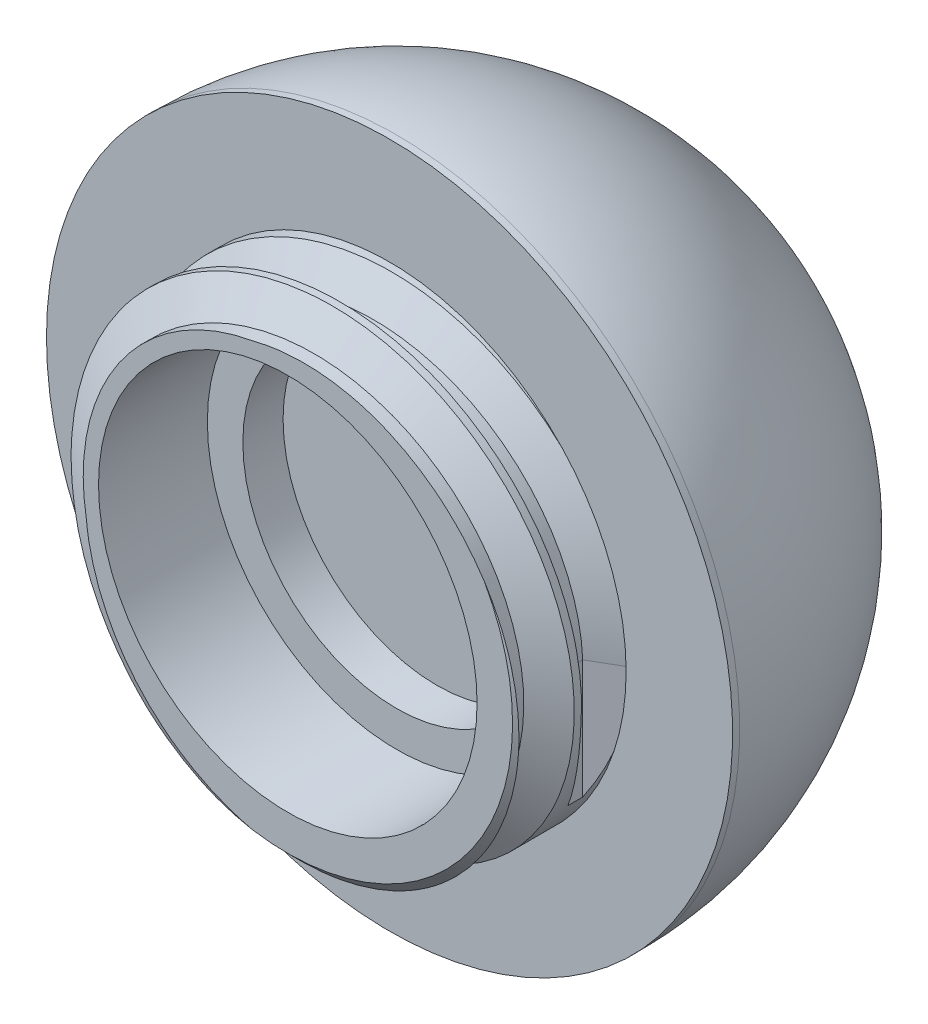
from build123d import *
from build123d.topology import SkipClean

# Parameters (mm, degrees)
SKETCH4_R           = 25.4
SKETCH4_R_2         = 20.32
BOSS_EXTRUDE1_DEPTH = 11.684
CHAMFER1_SIZE       = 1.27
THREAD3_PITCH       = 6.35
CUT_EXTRUDE2_DEPTH  = 64.791431358
SKETCH19_R          = 16.51
CUT_EXTRUDE3_DEPTH  = 4.318
SKETCH21_R          = 36.83
SKETCH21_R_2        = 25.4
BOSS_EXTRUDE2_DEPTH = 0.762


with BuildPart() as part:
    # Sketch1 → Revolve1 (revolve)
    with BuildSketch(Plane(origin=(0, 0, 0), x_dir=(1, 0, 0), z_dir=(0, 1, 0))):
        with BuildLine():
            Line((0, 0), (0, 36.83))
            ThreePointArc((0, 36.83), (-26.042742751, 26.042742751), (-36.83, 0))
            Line((-36.83, 0), (0, 0))
        make_face()
    revolve(axis=Axis((0, 0, 0), (0, 0, -1)))

    # Sketch4 → Boss-Extrude1 (add)
    with BuildSketch(Plane.XY):
        with Locations(Location((0, 0, 0), (0, 0, 180))):
            Circle(SKETCH4_R)
        Circle(SKETCH4_R_2, mode=Mode.SUBTRACT)
    extrude(amount=BOSS_EXTRUDE1_DEPTH)

    # Chamfer1
    chamfer1_edges = [part.edges().sort_by_distance(p)[0] for p in [
        (25.4, 0, 11.684),
    ]]
    chamfer(chamfer1_edges, length=CHAMFER1_SIZE)

    # Thread3: the profile of Thread Profile4 profile screwed along a right-hand helix of 1.84 turns, 14 arcs to a turn; built about Z, then put on its axis
    with SkipClean():  # the faces are left unmerged after this step: merging them gives an invalid solid
        thread3_z = Axis((0, 0, 0), (0, 0, 1))
        thread3_corners = [(25.4003, 0, -0.000173205), (25.4003, 0, 5.556423188), (21.962961694, 0, 3.571874991), (21.962961694, 0, 1.984374991)]
        with BuildLine(mode=Mode.PRIVATE) as thread3_profile:
            Line(thread3_corners[0], thread3_corners[1])
            Line(thread3_corners[1], thread3_corners[2])
            Line(thread3_corners[2], thread3_corners[3])
            Line(thread3_corners[3], thread3_corners[0])
        thread3_cap = Face(thread3_profile.wire())
        thread3_turn_angles = [0, 12.857142857, 25.714285714, 38.571428571, 51.428571429, 64.285714286, 77.142857143, 90, 102.857142857, 115.714285714, 128.571428571, 141.428571429, 154.285714286, 167.142857143, 180, 192.857142857, 205.714285714, 218.571428571, 231.428571429, 244.285714286, 257.142857143, 270, 282.857142857, 295.714285714, 308.571428571, 321.428571429, 334.285714286, 347.142857143, 360]
        thread3_turn_weights = [1, 0.9749279121818236, 1, 0.9749279121818236, 1, 0.9749279121818236, 1, 0.9749279121818236, 1, 0.9749279121818236, 1, 0.9749279121818236, 1, 0.9749279121818236, 1, 0.9749279121818236, 1, 0.9749279121818236, 1, 0.9749279121818236, 1, 0.9749279121818236, 1, 0.9749279121818237, 1, 0.9749279121818236, 1, 0.9749279121818236, 1]
        thread3_turn_rails = [Edge.make_bspline([Vector(p[0], p[1], 0).rotate(thread3_z, thread3_turn_angles[k]) / thread3_turn_weights[k] + Vector(0, 0, p[2] + THREAD3_PITCH * thread3_turn_angles[k] / 360) for k in range(29)], [0, 0, 0, 1, 1, 2, 2, 3, 3, 4, 4, 5, 5, 6, 6, 7, 7, 8, 8, 9, 9, 10, 10, 11, 11, 12, 12, 13, 13, 14, 14, 14], 2, thread3_turn_weights) for p in thread3_corners]
        thread3_turn_sides = [Face.make_surface_from_curves(thread3_turn_rails[p[0]], thread3_turn_rails[p[1]]) for p in [(0, 1), (1, 2), (2, 3), (3, 0)]]
        thread3_last_angles = [360, 372.857142857, 385.714285714, 398.571428571, 411.428571429, 424.285714286, 437.142857143, 450, 462.857142857, 475.714285714, 488.571428571, 501.428571429, 514.285714286, 527.142857143, 540, 552.857142857, 565.714285714, 578.571428571, 591.428571429, 604.285714286, 617.142857143, 630, 642.857142857, 652.628571429, 662.4]
        thread3_last_weights = [1, 0.9749279121818236, 1, 0.9749279121818236, 1, 0.9749279121818237, 1, 0.9749279121818235, 1, 0.9749279121818237, 1, 0.9749279121818237, 1, 0.9749279121818235, 1, 0.9749279121818235, 1, 0.9749279121818237, 1, 0.9749279121818237, 1, 0.9749279121818235, 1, 0.9854926535657266, 1]
        thread3_last_rails = [Edge.make_bspline([Vector(p[0], p[1], 0).rotate(thread3_z, thread3_last_angles[k]) / thread3_last_weights[k] + Vector(0, 0, p[2] + THREAD3_PITCH * thread3_last_angles[k] / 360) for k in range(25)], [0, 0, 0, 1, 1, 2, 2, 3, 3, 4, 4, 5, 5, 6, 6, 7, 7, 8, 8, 9, 9, 10, 10, 11, 11, 12, 12, 12], 2, thread3_last_weights) for p in thread3_corners]
        thread3_last_sides = [Face.make_surface_from_curves(thread3_last_rails[p[0]], thread3_last_rails[p[1]]) for p in [(0, 1), (1, 2), (2, 3), (3, 0)]]
        thread3 = Plane(origin=(0, 0, 0), x_dir=(1, 0, 0), z_dir=(0, 0, 1)) * Solid(Shell([*thread3_turn_sides, *thread3_last_sides, thread3_cap, thread3_cap.rotate(thread3_z, 662.4).moved(Location((0, 0, THREAD3_PITCH * 662.4 / 360)))]))
        add(thread3, mode=Mode.SUBTRACT)

    # Sketch18 → Cut-Extrude2 (cut, through all)
    with SkipClean():  # the faces are left unmerged after this step: merging them gives an invalid solid
        with BuildSketch(Plane(origin=(0, 0, 0), x_dir=(1, 0, 0), z_dir=(0, 1, 0))):
            Polygon((25.4, 0), (21.962961694, -1.984374991), (21.962961694, -3.571874991), (25.4, -5.556249983), align=None)
        extrude(amount=-CUT_EXTRUDE2_DEPTH, mode=Mode.SUBTRACT)

    # Sketch19 → Cut-Extrude3 (cut)
    with SkipClean():  # the faces are left unmerged after this step: merging them gives an invalid solid
        with BuildSketch(Plane.XY):
            Circle(SKETCH19_R)
        extrude(amount=-CUT_EXTRUDE3_DEPTH, mode=Mode.SUBTRACT)

    # Sketch21 → Boss-Extrude2 (add)
    with SkipClean():  # the faces are left unmerged after this step: merging them gives an invalid solid
        with BuildSketch(Plane.XY):
            with Locations(Location((0, 0, 0), (0, 0, 180))):
                Circle(SKETCH21_R)
            Circle(SKETCH21_R_2, mode=Mode.SUBTRACT)
        extrude(amount=BOSS_EXTRUDE2_DEPTH)


solid = part.part
